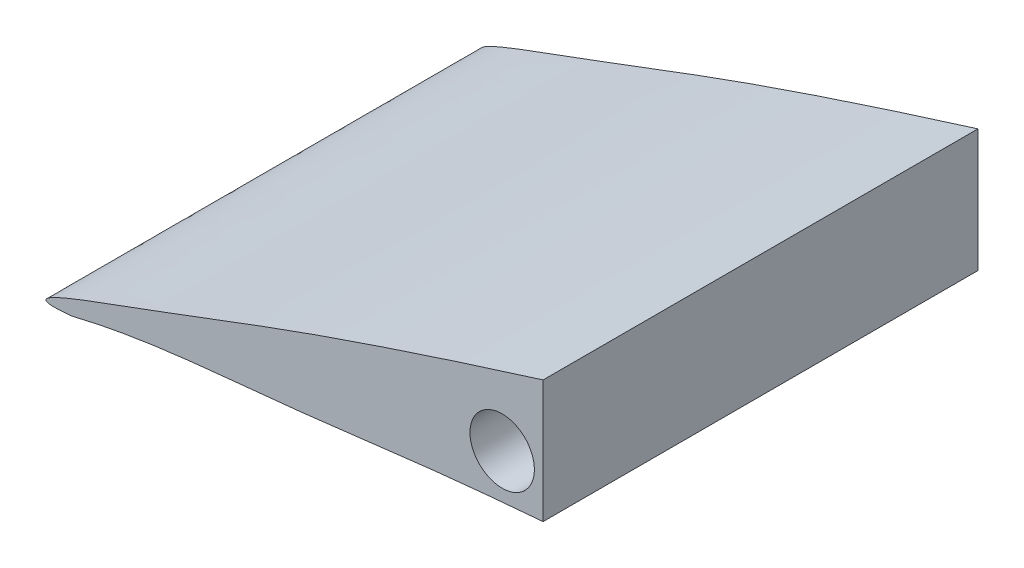
from build123d import *

# Parameters (mm, degrees)
SKETCH1_R           = 2
SKETCH1_R_2         = 2.127
SKETCH1_R_3         = 2.032
BOSS_EXTRUDE1_DEPTH = 26.9875
SKETCH2_W           = 104.732489184
SKETCH2_H           = 32.948386637
CUT_EXTRUDE1_DEPTH  = 27.0764


with BuildPart() as part:
    # Sketch1 → Boss-Extrude1 (new body)
    with BuildSketch(Plane.XY):
        with BuildLine():
            Line((42.918297493, -0.447743106), (42.918297493, 8.263094686))
            ThreePointArc((42.918297493, 8.263094686), (40.994864427, 12.243356636), (36.681098599, 13.209536914))
            add(Edge.make_bspline(
                [(36.681098599, 13.209536914), (19.829765645, 9.267240013), (-2.073589943, 3.844068304), (-31.096466219, -5.545914493), (-39.316765165, -8.806631661), (-49.515556323, -12.495660485), (-45.77248955, -12.10685039)],
                knots=[0.118068853, 0.118068853, 0.118068853, 0.118068853, 0.630725311, 0.824213609, 0.940085477, 1, 1, 1, 1], degree=3))
            add(Edge.make_bspline(
                [(-45.77248955, -12.10685039), (-41.337443699, -10.999265489), (-33.831609628, -10.530043097), (-20.483498257, -8.707547198), (-8.873433654, -8.01917435), (11.524588595, -6.028171323), (26.067321973, -5.659784939), (37.895141959, -5.527425055)],
                knots=[0, 0, 0, 0, 0.144322392, 0.237947652, 0.42712275, 0.512831912, 0.887817721, 0.887817721, 0.887817721, 0.887817721], degree=3))
            ThreePointArc((37.895141959, -5.527425055), (41.450441586, -4.019691462), (42.918297493, -0.447743106))
        make_face()
        with Locations((-19.10248955, -6.01085039)):
            Circle(SKETCH1_R, mode=Mode.SUBTRACT)
        with Locations((12.64751045, 4.40314961)):
            Circle(SKETCH1_R_2, mode=Mode.SUBTRACT)
        with Locations((33.89346968, 3.421717851)):
            Circle(SKETCH1_R_3, mode=Mode.SUBTRACT)
    extrude(amount=BOSS_EXTRUDE1_DEPTH)

    # Sketch2 → Cut-Extrude1 (cut)
    with BuildSketch(Plane.XY.offset(26.9875)):
        with Locations((35.803755042, -2.355433399)):
            Rectangle(SKETCH2_W, SKETCH2_H)
    extrude(amount=-CUT_EXTRUDE1_DEPTH, mode=Mode.SUBTRACT)


solid = part.part
